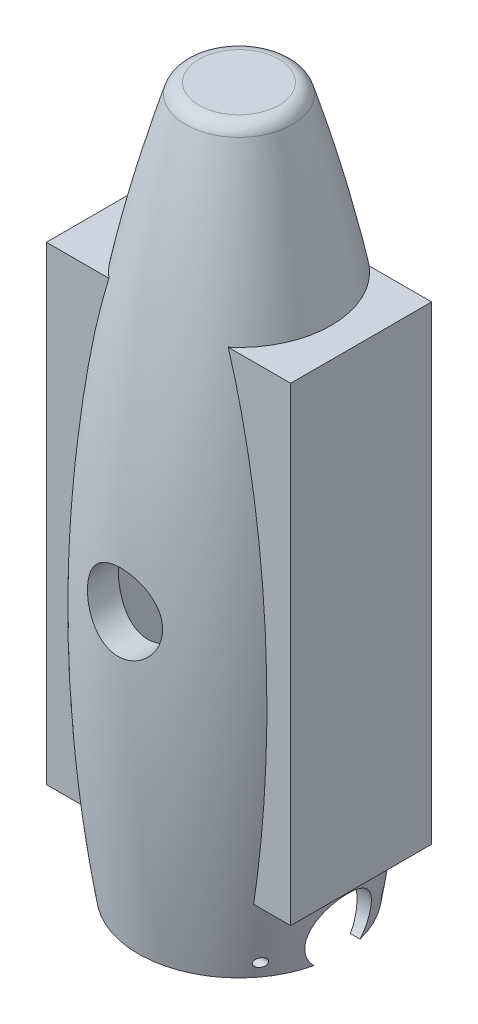
from build123d import *

# Parameters (mm, degrees)
FILLET_ON_TOP_EDGE_R                 = 3
SKETCH7_R                            = 7
CUT_FOR_WIRES_DEPTH                  = 150.507360339
SKETCH8_R                            = 19.424285286
CUT_FOR_HOLLOW_INSIDE_DEPTH          = 105
SKETCH9_R                            = 8
CUT_FOR_SIDE_BUTTON_DEPTH            = 150.507360339
RIGHT_PCB_PLATE_REACH                = 158.103
SKETCH10_W                           = 30
SKETCH10_H                           = 100
CUTS_FOR_BODY_SCREW_HOLES_DEPTH      = 150.548404931
CUTS_FOR_BODY_SCREW_HOLES_DEPTH_BACK = 150.548404931
SKETCH11_R                           = 1
SKETCH12_R                           = 9
ANOTHER_CUT_FOR_HOLLOW_INSIDE_DEPTH  = 40


with BuildPart() as part:
    # Sketch2 → Main Body (revolve)
    with BuildSketch(Plane.XY):
        with BuildLine():
            Line((0, 145), (0, -5))
            Line((0, -5), (21.424285286, -5))
            add(Edge.make_bspline(
                [(10.712142643, 145), (33.843636783, 71.251754866), (21.424285286, -5)],
                knots=[0, 0, 0, 1, 1, 1], degree=2))
            Line((10.712142643, 145), (0, 145))
        make_face()
    revolve(axis=Axis((0, 145, 0), (0, -1, 0)))

    # Fillet on Top Edge
    fillet_on_top_edge_edges = [part.edges().sort_by_distance(p)[0] for p in [
        (-10.712142643, 145, 0),
    ]]
    fillet(fillet_on_top_edge_edges, radius=FILLET_ON_TOP_EDGE_R)

    # Sketch7 → Cut for Wires (cut, through all)
    with BuildSketch(Plane(origin=(0, 0, 0), x_dir=(0, 0, -1), z_dir=(1, 0, 0))):
        Circle(SKETCH7_R)
    extrude(amount=CUT_FOR_WIRES_DEPTH, mode=Mode.SUBTRACT)

    # Sketch8 → Cut for Hollow Inside (cut)
    with BuildSketch(Plane.XZ.offset(5)):
        Circle(SKETCH8_R)
    extrude(amount=-CUT_FOR_HOLLOW_INSIDE_DEPTH, mode=Mode.SUBTRACT)

    # Sketch9 → Cut for Side Button (cut, through all)
    with BuildSketch(Plane.XY):
        with Locations((0, 60)):
            Circle(SKETCH9_R)
    extrude(amount=CUT_FOR_SIDE_BUTTON_DEPTH, mode=Mode.SUBTRACT)

    # Sketch10 → Right PCB Plate (add, up to next)
    with BuildSketch(Plane(origin=(-26, 0, 0), x_dir=(0, 0, -1), z_dir=(1, 0, 0)), mode=Mode.PRIVATE) as right_pcb_plate_sk1:
        with Locations((0, 60)):
            Rectangle(SKETCH10_W, SKETCH10_H)
    right_pcb_plate_tool1 = extrude(right_pcb_plate_sk1.sketch, amount=RIGHT_PCB_PLATE_REACH, mode=Mode.PRIVATE) - part.part
    right_pcb_plate = right_pcb_plate_tool1.solids().sort_by_distance((-26, 60, 0))[0]
    add(right_pcb_plate)

    # Left PCB Plate: Right PCB Plate across plane
    add(right_pcb_plate.mirror(Plane(origin=(0, 0, 0), x_dir=(0, 0, 1), z_dir=(1, 0, 0))))

    # Sketch11 → Cuts for Body Screw Holes (cut, two sides: drawn at the far end of the back side and taken through both)
    with BuildSketch(Plane(origin=(0, 0, 0), x_dir=(0, 0, -1), z_dir=(1, 0, 0)).offset(-CUTS_FOR_BODY_SCREW_HOLES_DEPTH_BACK)):
        with Locations((-13, -2)):
            Circle(SKETCH11_R)
        with Locations((13, -2)):
            Circle(SKETCH11_R)
    extrude(amount=CUTS_FOR_BODY_SCREW_HOLES_DEPTH + CUTS_FOR_BODY_SCREW_HOLES_DEPTH_BACK, mode=Mode.SUBTRACT)

    # Sketch12 → Another Cut for Hollow Inside (cut)
    with BuildSketch(Plane.XZ.offset(-100)):
        Circle(SKETCH12_R)
    extrude(amount=-ANOTHER_CUT_FOR_HOLLOW_INSIDE_DEPTH, mode=Mode.SUBTRACT)


solid = part.part
